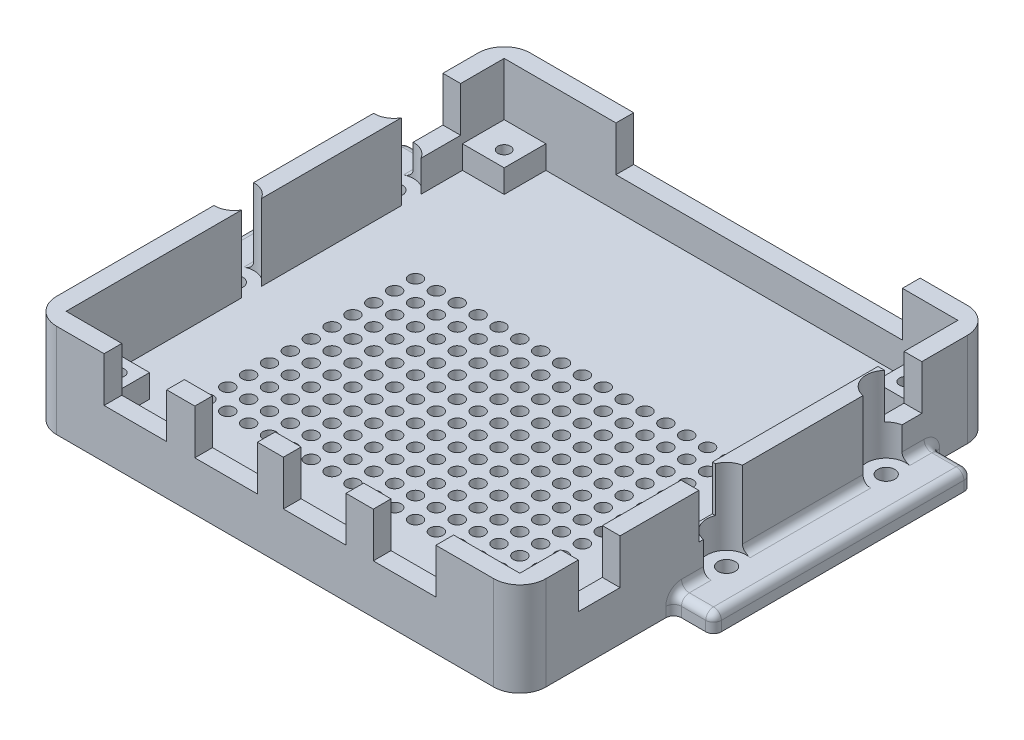
from build123d import *

# Parameters (mm, degrees)
BOSS_EXTRUDE2_DEPTH   = 10.922
BOSS_EXTRUDE2_2_DEPTH = 10.922
BOSS_EXTRUDE2_3_DEPTH = 10.922
SKETCH1_W             = 4.318
SKETCH1_H             = 40.3352
BOSS_EXTRUDE2_4_DEPTH = 10.922
SKETCH1_H_2           = 19.177
BOSS_EXTRUDE2_5_DEPTH = 10.922
BOSS_EXTRUDE2_6_DEPTH = 10.922
SKETCH1_W_2           = 6.6548
SKETCH1_H_3           = 4.318
BOSS_EXTRUDE2_7_DEPTH = 10.922
SKETCH1_W_3           = 6.3246
BOSS_EXTRUDE2_8_DEPTH = 10.922
SKETCH1_W_4           = 6.858
BOSS_EXTRUDE2_9_DEPTH = 10.922
SKETCH2_W             = 4.318
SKETCH2_H             = 86.36
SKETCH2_W_2           = 90.17
SKETCH2_H_2           = 4.318
SKETCH2_H_3           = 12.70543687
SKETCH2_H_4           = 0.4445
SKETCH2_H_5           = 73.21006313
SKETCH2_W_3           = 3.4036
SKETCH2_W_4           = 86.7664
BOSS_EXTRUDE4_DEPTH   = 7.62
SKETCH5_W             = 7.62
SKETCH5_H             = 7.62
SKETCH5_R             = 1.524
BOSS_EXTRUDE6_DEPTH   = 5.62
SKETCH6_W             = 119.126
SKETCH6_H             = 115.316
SKETCH6_R             = 1.524
BOSS_EXTRUDE7_DEPTH   = 4.318
SKETCH7_R             = 1.5875
CUT_EXTRUDE1_DEPTH    = 4.318
FILLET1_R             = 6.35
BOSS_EXTRUDE8_DEPTH   = 4.318
SKETCH9_R             = 2.0955
CUT_EXTRUDE2_DEPTH    = 22.86
SKETCH10_R            = 4.826
CUT_EXTRUDE3_DEPTH    = 18.542
FILLET14_R            = 1.905
FILLET15_R            = 1.905


with BuildPart() as part:
    # Sketch1 → Boss-Extrude2 (new body)
    with BuildSketch(Plane(origin=(0, 60.324413717, 0), x_dir=(1, 0, 0), z_dir=(0, 1, 0))):
        Polygon((-24.756688695, -58.711999847), (-24.756688695, -146.400062977), (-6.875088695, -146.400062977), (-6.875088695, -142.082062977), (-20.438688695, -142.082062977), (-20.438688695, -58.711999847), align=None)
    extrude(amount=BOSS_EXTRUDE2_DEPTH)



with BuildPart() as body_2:
    # Sketch1 → Boss-Extrude2 2 (new body)
    with BuildSketch(Plane(origin=(0, 60.324413717, 0), x_dir=(1, 0, 0), z_dir=(0, 1, 0))):
        Polygon((6.788511305, -35.402062977), (-20.438688695, -35.402062977), (-20.438688695, -46.006562977), (-24.756688695, -46.006562977), (-24.756688695, -31.084062977), (6.788511305, -31.084062977), align=None)
    extrude(amount=BOSS_EXTRUDE2_2_DEPTH)


with BuildPart() as body_3:
    # Sketch1 → Boss-Extrude2 3 (new body)
    with BuildSketch(Plane(origin=(0, 60.324413717, 0), x_dir=(1, 0, 0), z_dir=(0, 1, 0))):
        Polygon((90.051311305, -48.508462977), (90.051311305, -35.402062977), (76.540111305, -35.402062977), (76.540111305, -31.084062977), (94.369311305, -31.084062977), (94.369311305, -48.508462977), align=None)
    extrude(amount=BOSS_EXTRUDE2_3_DEPTH)


with BuildPart() as body_4:
    # Sketch1 → Boss-Extrude2 4 (new body)
    with BuildSketch(Plane(origin=(0, 60.324413717, 0), x_dir=(1, 0, 0), z_dir=(0, 1, 0))):
        with Locations((92.210311305, -75.026062977)):
            Rectangle(SKETCH1_W, SKETCH1_H)
    extrude(amount=BOSS_EXTRUDE2_4_DEPTH)


with BuildPart() as body_5:
    # Sketch1 → Boss-Extrude2 5 (new body)
    with BuildSketch(Plane(origin=(0, 60.324413717, 0), x_dir=(1, 0, 0), z_dir=(0, 1, 0))):
        with Locations((92.210311305, -112.402162977)):
            Rectangle(SKETCH1_W, SKETCH1_H_2)
    extrude(amount=BOSS_EXTRUDE2_5_DEPTH)


with BuildPart() as body_6:
    # Sketch1 → Boss-Extrude2 6 (new body)
    with BuildSketch(Plane(origin=(0, 60.324413717, 0), x_dir=(1, 0, 0), z_dir=(0, 1, 0))):
        Polygon((73.922311305, -142.082062977), (90.051311305, -142.082062977), (90.051311305, -132.150662977), (94.369311305, -132.150662977), (94.369311305, -146.400062977), (73.922311305, -146.400062977), align=None)
    extrude(amount=BOSS_EXTRUDE2_6_DEPTH)


with BuildPart() as body_7:
    # Sketch1 → Boss-Extrude2 7 (new body)
    with BuildSketch(Plane(origin=(0, 60.324413717, 0), x_dir=(1, 0, 0), z_dir=(0, 1, 0))):
        with Locations((55.354911305, -144.241062977)):
            Rectangle(SKETCH1_W_2, SKETCH1_H_3)
    extrude(amount=BOSS_EXTRUDE2_7_DEPTH)


with BuildPart() as body_8:
    # Sketch1 → Boss-Extrude2 8 (new body)
    with BuildSketch(Plane(origin=(0, 60.324413717, 0), x_dir=(1, 0, 0), z_dir=(0, 1, 0))):
        with Locations((33.625211305, -144.241062977)):
            Rectangle(SKETCH1_W_3, SKETCH1_H_3)
    extrude(amount=BOSS_EXTRUDE2_8_DEPTH)


with BuildPart() as body_9:
    # Sketch1 → Boss-Extrude2 9 (new body)
    with BuildSketch(Plane(origin=(0, 60.324413717, 0), x_dir=(1, 0, 0), z_dir=(0, 1, 0))):
        with Locations((11.793911305, -144.241062977)):
            Rectangle(SKETCH1_W_4, SKETCH1_H_3)
    extrude(amount=BOSS_EXTRUDE2_9_DEPTH)


with BuildPart() as part_1:
    add(part.part)

    add(body_2.part)  # Boss-Extrude4 merges body 2

    add(body_3.part)  # Boss-Extrude4 merges body 3

    add(body_4.part)  # Boss-Extrude4 merges body 4

    add(body_5.part)  # Boss-Extrude4 merges body 5

    add(body_6.part)  # Boss-Extrude4 merges body 6

    add(body_7.part)  # Boss-Extrude4 merges body 7

    add(body_8.part)  # Boss-Extrude4 merges body 8

    add(body_9.part)  # Boss-Extrude4 merges body 9
    # Sketch2 → Boss-Extrude4 (add)
    with BuildSketch(Plane.XZ.offset(-60.324413717)):
        Polygon((94.369311305, 31.084062977), (94.369311305, 45.562062977), (90.051311305, 45.562062977), (90.051311305, 35.402062977), (79.891311305, 35.402062977), (79.891311305, 31.084062977), align=None)
        with Locations((92.210311305, 88.742062977)):
            Rectangle(SKETCH2_W, SKETCH2_H)
        Polygon((94.369311305, 146.400062977), (79.891311305, 146.400062977), (79.891311305, 142.082062977), (90.051311305, 142.082062977), (90.051311305, 131.922062977), (94.369311305, 131.922062977), align=None)
        with Locations((34.806311305, 33.243062977)):
            Rectangle(SKETCH2_W_2, SKETCH2_H_2)
        Polygon((-20.438688695, 45.562062977), (-24.756688695, 45.562062977), (-24.756688695, 31.084062977), (-10.278688695, 31.084062977), (-10.278688695, 35.402062977), (-20.438688695, 35.402062977), align=None)
        with Locations((-22.597688695, 52.359281412)):
            Rectangle(SKETCH2_W, SKETCH2_H_3)
        with Locations((-22.597688695, 45.784312977)):
            Rectangle(SKETCH2_W, SKETCH2_H_4)
        with Locations((-22.597688695, 95.317031412)):
            Rectangle(SKETCH2_W, SKETCH2_H_5)
        Polygon((-10.278688695, 146.400062977), (-24.756688695, 146.400062977), (-24.756688695, 131.922062977), (-20.438688695, 131.922062977), (-20.438688695, 142.082062977), (-10.278688695, 142.082062977), align=None)
        with Locations((-8.576888695, 144.241062977)):
            Rectangle(SKETCH2_W_3, SKETCH2_H_2)
        with Locations((36.508111305, 144.241062977)):
            Rectangle(SKETCH2_W_4, SKETCH2_H_2)
    extrude(amount=BOSS_EXTRUDE4_DEPTH)

    # Sketch5 → Boss-Extrude6 (add)
    # profile 1 of 8: a face of its own
    with BuildSketch(Plane.XZ.offset(-58.324413717)):
        Polygon((-20.438688695, 131.922062977), (-17.898688695, 131.922062977), (-17.898688695, 139.542062977), (-10.278688695, 139.542062977), (-10.278688695, 142.082062977), (-20.438688695, 142.082062977), align=None)
    # profile 2 of 8: a face of its own
    with BuildSketch(Plane.XZ.offset(-58.324413717)):
        with Locations((-14.088688695, 135.732062977)):
            Rectangle(SKETCH5_W, SKETCH5_H)
        with Locations(Location((-14.088688695, 135.732062977, 0), (0, 0, 270))):
            Circle(SKETCH5_R, mode=Mode.SUBTRACT)
    # profile 3 of 8: a face of its own
    with BuildSketch(Plane.XZ.offset(-58.324413717)):
        with Locations((83.701311305, 135.732062977)):
            Rectangle(SKETCH5_W, SKETCH5_H)
        with Locations(Location((83.701311305, 135.732062977, 0), (0, 0, 270))):
            Circle(SKETCH5_R, mode=Mode.SUBTRACT)
    # profile 4 of 8: a face of its own
    with BuildSketch(Plane.XZ.offset(-58.324413717)):
        Polygon((79.891311305, 142.082062977), (79.891311305, 139.542062977), (87.511311305, 139.542062977), (87.511311305, 131.922062977), (90.051311305, 131.922062977), (90.051311305, 142.082062977), align=None)
    # profile 5 of 8: a face of its own
    with BuildSketch(Plane.XZ.offset(-58.324413717)):
        with Locations((83.701311305, 41.752062977)):
            Rectangle(SKETCH5_W, SKETCH5_H)
        with Locations(Location((83.701311305, 41.752062977, 0), (0, 0, 270))):
            Circle(SKETCH5_R, mode=Mode.SUBTRACT)
    # profile 6 of 8: a face of its own
    with BuildSketch(Plane.XZ.offset(-58.324413717)):
        Polygon((87.511311305, 37.942062977), (79.891311305, 37.942062977), (79.891311305, 35.402062977), (90.051311305, 35.402062977), (90.051311305, 45.562062977), (87.511311305, 45.562062977), align=None)
    # profile 7 of 8: a face of its own
    with BuildSketch(Plane.XZ.offset(-58.324413717)):
        with Locations((-14.088688695, 41.752062977)):
            Rectangle(SKETCH5_W, SKETCH5_H)
        with Locations(Location((-14.088688695, 41.752062977, 0), (0, 0, 270))):
            Circle(SKETCH5_R, mode=Mode.SUBTRACT)
    # profile 8 of 8: a face of its own
    with BuildSketch(Plane.XZ.offset(-58.324413717)):
        Polygon((-17.898688695, 37.942062977), (-17.898688695, 45.562062977), (-20.438688695, 45.562062977), (-20.438688695, 35.402062977), (-10.278688695, 35.402062977), (-10.278688695, 37.942062977), align=None)
    extrude(amount=BOSS_EXTRUDE6_DEPTH)

    # Sketch6 → Boss-Extrude7 (add)
    with BuildSketch(Plane(origin=(0, 52.704413717, 0), x_dir=(-1, 0, 0), z_dir=(0, -1, 0))):
        with Locations((-34.806311305, -88.742062977)):
            Rectangle(SKETCH6_W, SKETCH6_H)
        with Locations(Location((14.088688695, -135.732062977, 0), (0, 0, 90))):
            Circle(SKETCH6_R, mode=Mode.SUBTRACT)
        with Locations(Location((-83.701311305, -135.732062977, 0), (0, 0, 90))):
            Circle(SKETCH6_R, mode=Mode.SUBTRACT)
        with Locations(Location((-83.701311305, -41.752062977, 0), (0, 0, 90))):
            Circle(SKETCH6_R, mode=Mode.SUBTRACT)
        with Locations(Location((14.088688695, -41.752062977, 0), (0, 0, 90))):
            Circle(SKETCH6_R, mode=Mode.SUBTRACT)
    extrude(amount=BOSS_EXTRUDE7_DEPTH)

    # Sketch7 → Cut-Extrude1 (cut)
    with BuildSketch(Plane.XZ.offset(-48.386413717)):
        with Locations(Location((72.906311305, 74.137062977, 0), (0, 0, 270))):
            Circle(SKETCH7_R)
        with Locations(Location((67.826311305, 74.137062977, 0), (0, 0, 270))):
            Circle(SKETCH7_R)
        with Locations(Location((62.746311305, 74.137062977, 0), (0, 0, 270))):
            Circle(SKETCH7_R)
        with Locations(Location((57.666311305, 74.137062977, 0), (0, 0, 270))):
            Circle(SKETCH7_R)
        with Locations(Location((52.586311305, 74.137062977, 0), (0, 0, 270))):
            Circle(SKETCH7_R)
        with Locations(Location((47.506311305, 74.137062977, 0), (0, 0, 270))):
            Circle(SKETCH7_R)
        with Locations(Location((42.426311305, 74.137062977, 0), (0, 0, 270))):
            Circle(SKETCH7_R)
        with Locations(Location((37.346311305, 74.137062977, 0), (0, 0, 270))):
            Circle(SKETCH7_R)
        with Locations(Location((32.266311305, 74.137062977, 0), (0, 0, 270))):
            Circle(SKETCH7_R)
        with Locations(Location((27.186311305, 74.137062977, 0), (0, 0, 270))):
            Circle(SKETCH7_R)
        with Locations(Location((22.106311305, 74.137062977, 0), (0, 0, 270))):
            Circle(SKETCH7_R)
        with Locations(Location((17.026311305, 74.137062977, 0), (0, 0, 270))):
            Circle(SKETCH7_R)
        with Locations(Location((11.946311305, 74.137062977, 0), (0, 0, 270))):
            Circle(SKETCH7_R)
        with Locations(Location((6.866311305, 74.137062977, 0), (0, 0, 270))):
            Circle(SKETCH7_R)
        with Locations(Location((1.786311305, 74.137062977, 0), (0, 0, 270))):
            Circle(SKETCH7_R)
        with Locations(Location((-3.293688695, 74.137062977, 0), (0, 0, 270))):
            Circle(SKETCH7_R)
        with Locations(Location((72.906311305, 79.217062977, 0), (0, 0, 270))):
            Circle(SKETCH7_R)
        with Locations(Location((67.826311305, 79.217062977, 0), (0, 0, 270))):
            Circle(SKETCH7_R)
        with Locations(Location((62.746311305, 79.217062977, 0), (0, 0, 270))):
            Circle(SKETCH7_R)
        with Locations(Location((57.666311305, 79.217062977, 0), (0, 0, 270))):
            Circle(SKETCH7_R)
        with Locations(Location((52.586311305, 79.217062977, 0), (0, 0, 270))):
            Circle(SKETCH7_R)
        with Locations(Location((47.506311305, 79.217062977, 0), (0, 0, 270))):
            Circle(SKETCH7_R)
        with Locations(Location((42.426311305, 79.217062977, 0), (0, 0, 270))):
            Circle(SKETCH7_R)
        with Locations(Location((37.346311305, 79.217062977, 0), (0, 0, 270))):
            Circle(SKETCH7_R)
        with Locations(Location((32.266311305, 79.217062977, 0), (0, 0, 270))):
            Circle(SKETCH7_R)
        with Locations(Location((27.186311305, 79.217062977, 0), (0, 0, 270))):
            Circle(SKETCH7_R)
        with Locations(Location((22.106311305, 79.217062977, 0), (0, 0, 270))):
            Circle(SKETCH7_R)
        with Locations(Location((17.026311305, 79.217062977, 0), (0, 0, 270))):
            Circle(SKETCH7_R)
        with Locations(Location((11.946311305, 79.217062977, 0), (0, 0, 270))):
            Circle(SKETCH7_R)
        with Locations(Location((6.866311305, 79.217062977, 0), (0, 0, 270))):
            Circle(SKETCH7_R)
        with Locations(Location((1.786311305, 79.217062977, 0), (0, 0, 270))):
            Circle(SKETCH7_R)
        with Locations(Location((-3.293688695, 79.217062977, 0), (0, 0, 270))):
            Circle(SKETCH7_R)
        with Locations(Location((72.906311305, 84.297062977, 0), (0, 0, 270))):
            Circle(SKETCH7_R)
        with Locations(Location((67.826311305, 84.297062977, 0), (0, 0, 270))):
            Circle(SKETCH7_R)
        with Locations(Location((62.746311305, 84.297062977, 0), (0, 0, 270))):
            Circle(SKETCH7_R)
        with Locations(Location((57.666311305, 84.297062977, 0), (0, 0, 270))):
            Circle(SKETCH7_R)
        with Locations(Location((52.586311305, 84.297062977, 0), (0, 0, 270))):
            Circle(SKETCH7_R)
        with Locations(Location((47.506311305, 84.297062977, 0), (0, 0, 270))):
            Circle(SKETCH7_R)
        with Locations(Location((42.426311305, 84.297062977, 0), (0, 0, 270))):
            Circle(SKETCH7_R)
        with Locations(Location((37.346311305, 84.297062977, 0), (0, 0, 270))):
            Circle(SKETCH7_R)
        with Locations(Location((32.266311305, 84.297062977, 0), (0, 0, 270))):
            Circle(SKETCH7_R)
        with Locations(Location((27.186311305, 84.297062977, 0), (0, 0, 270))):
            Circle(SKETCH7_R)
        with Locations(Location((22.106311305, 84.297062977, 0), (0, 0, 270))):
            Circle(SKETCH7_R)
        with Locations(Location((17.026311305, 84.297062977, 0), (0, 0, 270))):
            Circle(SKETCH7_R)
        with Locations(Location((11.946311305, 84.297062977, 0), (0, 0, 270))):
            Circle(SKETCH7_R)
        with Locations(Location((6.866311305, 84.297062977, 0), (0, 0, 270))):
            Circle(SKETCH7_R)
        with Locations(Location((1.786311305, 84.297062977, 0), (0, 0, 270))):
            Circle(SKETCH7_R)
        with Locations(Location((-3.293688695, 84.297062977, 0), (0, 0, 270))):
            Circle(SKETCH7_R)
        with Locations(Location((72.906311305, 89.377062977, 0), (0, 0, 270))):
            Circle(SKETCH7_R)
        with Locations(Location((67.826311305, 89.377062977, 0), (0, 0, 270))):
            Circle(SKETCH7_R)
        with Locations(Location((62.746311305, 89.377062977, 0), (0, 0, 270))):
            Circle(SKETCH7_R)
        with Locations(Location((57.666311305, 89.377062977, 0), (0, 0, 270))):
            Circle(SKETCH7_R)
        with Locations(Location((52.586311305, 89.377062977, 0), (0, 0, 270))):
            Circle(SKETCH7_R)
        with Locations(Location((47.506311305, 89.377062977, 0), (0, 0, 270))):
            Circle(SKETCH7_R)
        with Locations(Location((42.426311305, 89.377062977, 0), (0, 0, 270))):
            Circle(SKETCH7_R)
        with Locations(Location((37.346311305, 89.377062977, 0), (0, 0, 270))):
            Circle(SKETCH7_R)
        with Locations(Location((32.266311305, 89.377062977, 0), (0, 0, 270))):
            Circle(SKETCH7_R)
        with Locations(Location((27.186311305, 89.377062977, 0), (0, 0, 270))):
            Circle(SKETCH7_R)
        with Locations(Location((22.106311305, 89.377062977, 0), (0, 0, 270))):
            Circle(SKETCH7_R)
        with Locations(Location((17.026311305, 89.377062977, 0), (0, 0, 270))):
            Circle(SKETCH7_R)
        with Locations(Location((11.946311305, 89.377062977, 0), (0, 0, 270))):
            Circle(SKETCH7_R)
        with Locations(Location((6.866311305, 89.377062977, 0), (0, 0, 270))):
            Circle(SKETCH7_R)
        with Locations(Location((1.786311305, 89.377062977, 0), (0, 0, 270))):
            Circle(SKETCH7_R)
        with Locations(Location((-3.293688695, 89.377062977, 0), (0, 0, 270))):
            Circle(SKETCH7_R)
        with Locations(Location((72.906311305, 94.457062977, 0), (0, 0, 270))):
            Circle(SKETCH7_R)
        with Locations(Location((67.826311305, 94.457062977, 0), (0, 0, 270))):
            Circle(SKETCH7_R)
        with Locations(Location((62.746311305, 94.457062977, 0), (0, 0, 270))):
            Circle(SKETCH7_R)
        with Locations(Location((57.666311305, 94.457062977, 0), (0, 0, 270))):
            Circle(SKETCH7_R)
        with Locations(Location((52.586311305, 94.457062977, 0), (0, 0, 270))):
            Circle(SKETCH7_R)
        with Locations(Location((47.506311305, 94.457062977, 0), (0, 0, 270))):
            Circle(SKETCH7_R)
        with Locations(Location((42.426311305, 94.457062977, 0), (0, 0, 270))):
            Circle(SKETCH7_R)
        with Locations(Location((37.346311305, 94.457062977, 0), (0, 0, 270))):
            Circle(SKETCH7_R)
        with Locations(Location((32.266311305, 94.457062977, 0), (0, 0, 270))):
            Circle(SKETCH7_R)
        with Locations(Location((27.186311305, 94.457062977, 0), (0, 0, 270))):
            Circle(SKETCH7_R)
        with Locations(Location((22.106311305, 94.457062977, 0), (0, 0, 270))):
            Circle(SKETCH7_R)
        with Locations(Location((17.026311305, 94.457062977, 0), (0, 0, 270))):
            Circle(SKETCH7_R)
        with Locations(Location((11.946311305, 94.457062977, 0), (0, 0, 270))):
            Circle(SKETCH7_R)
        with Locations(Location((6.866311305, 94.457062977, 0), (0, 0, 270))):
            Circle(SKETCH7_R)
        with Locations(Location((1.786311305, 94.457062977, 0), (0, 0, 270))):
            Circle(SKETCH7_R)
        with Locations(Location((-3.293688695, 94.457062977, 0), (0, 0, 270))):
            Circle(SKETCH7_R)
        with Locations(Location((72.906311305, 99.537062977, 0), (0, 0, 270))):
            Circle(SKETCH7_R)
        with Locations(Location((67.826311305, 99.537062977, 0), (0, 0, 270))):
            Circle(SKETCH7_R)
        with Locations(Location((62.746311305, 99.537062977, 0), (0, 0, 270))):
            Circle(SKETCH7_R)
        with Locations(Location((57.666311305, 99.537062977, 0), (0, 0, 270))):
            Circle(SKETCH7_R)
        with Locations(Location((52.586311305, 99.537062977, 0), (0, 0, 270))):
            Circle(SKETCH7_R)
        with Locations(Location((47.506311305, 99.537062977, 0), (0, 0, 270))):
            Circle(SKETCH7_R)
        with Locations(Location((42.426311305, 99.537062977, 0), (0, 0, 270))):
            Circle(SKETCH7_R)
        with Locations(Location((37.346311305, 99.537062977, 0), (0, 0, 270))):
            Circle(SKETCH7_R)
        with Locations(Location((32.266311305, 99.537062977, 0), (0, 0, 270))):
            Circle(SKETCH7_R)
        with Locations(Location((27.186311305, 99.537062977, 0), (0, 0, 270))):
            Circle(SKETCH7_R)
        with Locations(Location((22.106311305, 99.537062977, 0), (0, 0, 270))):
            Circle(SKETCH7_R)
        with Locations(Location((17.026311305, 99.537062977, 0), (0, 0, 270))):
            Circle(SKETCH7_R)
        with Locations(Location((11.946311305, 99.537062977, 0), (0, 0, 270))):
            Circle(SKETCH7_R)
        with Locations(Location((6.866311305, 99.537062977, 0), (0, 0, 270))):
            Circle(SKETCH7_R)
        with Locations(Location((1.786311305, 99.537062977, 0), (0, 0, 270))):
            Circle(SKETCH7_R)
        with Locations(Location((-3.293688695, 99.537062977, 0), (0, 0, 270))):
            Circle(SKETCH7_R)
        with Locations(Location((72.906311305, 104.617062977, 0), (0, 0, 270))):
            Circle(SKETCH7_R)
        with Locations(Location((67.826311305, 104.617062977, 0), (0, 0, 270))):
            Circle(SKETCH7_R)
        with Locations(Location((62.746311305, 104.617062977, 0), (0, 0, 270))):
            Circle(SKETCH7_R)
        with Locations(Location((57.666311305, 104.617062977, 0), (0, 0, 270))):
            Circle(SKETCH7_R)
        with Locations(Location((52.586311305, 104.617062977, 0), (0, 0, 270))):
            Circle(SKETCH7_R)
        with Locations(Location((47.506311305, 104.617062977, 0), (0, 0, 270))):
            Circle(SKETCH7_R)
        with Locations(Location((42.426311305, 104.617062977, 0), (0, 0, 270))):
            Circle(SKETCH7_R)
        with Locations(Location((37.346311305, 104.617062977, 0), (0, 0, 270))):
            Circle(SKETCH7_R)
        with Locations(Location((32.266311305, 104.617062977, 0), (0, 0, 270))):
            Circle(SKETCH7_R)
        with Locations(Location((27.186311305, 104.617062977, 0), (0, 0, 270))):
            Circle(SKETCH7_R)
        with Locations(Location((22.106311305, 104.617062977, 0), (0, 0, 270))):
            Circle(SKETCH7_R)
        with Locations(Location((17.026311305, 104.617062977, 0), (0, 0, 270))):
            Circle(SKETCH7_R)
        with Locations(Location((11.946311305, 104.617062977, 0), (0, 0, 270))):
            Circle(SKETCH7_R)
        with Locations(Location((6.866311305, 104.617062977, 0), (0, 0, 270))):
            Circle(SKETCH7_R)
        with Locations(Location((1.786311305, 104.617062977, 0), (0, 0, 270))):
            Circle(SKETCH7_R)
        with Locations(Location((-3.293688695, 104.617062977, 0), (0, 0, 270))):
            Circle(SKETCH7_R)
        with Locations(Location((72.906311305, 109.697062977, 0), (0, 0, 270))):
            Circle(SKETCH7_R)
        with Locations(Location((67.826311305, 109.697062977, 0), (0, 0, 270))):
            Circle(SKETCH7_R)
        with Locations(Location((62.746311305, 109.697062977, 0), (0, 0, 270))):
            Circle(SKETCH7_R)
        with Locations(Location((57.666311305, 109.697062977, 0), (0, 0, 270))):
            Circle(SKETCH7_R)
        with Locations(Location((52.586311305, 109.697062977, 0), (0, 0, 270))):
            Circle(SKETCH7_R)
        with Locations(Location((47.506311305, 109.697062977, 0), (0, 0, 270))):
            Circle(SKETCH7_R)
        with Locations(Location((42.426311305, 109.697062977, 0), (0, 0, 270))):
            Circle(SKETCH7_R)
        with Locations(Location((37.346311305, 109.697062977, 0), (0, 0, 270))):
            Circle(SKETCH7_R)
        with Locations(Location((32.266311305, 109.697062977, 0), (0, 0, 270))):
            Circle(SKETCH7_R)
        with Locations(Location((27.186311305, 109.697062977, 0), (0, 0, 270))):
            Circle(SKETCH7_R)
        with Locations(Location((22.106311305, 109.697062977, 0), (0, 0, 270))):
            Circle(SKETCH7_R)
        with Locations(Location((17.026311305, 109.697062977, 0), (0, 0, 270))):
            Circle(SKETCH7_R)
        with Locations(Location((11.946311305, 109.697062977, 0), (0, 0, 270))):
            Circle(SKETCH7_R)
        with Locations(Location((6.866311305, 109.697062977, 0), (0, 0, 270))):
            Circle(SKETCH7_R)
        with Locations(Location((1.786311305, 109.697062977, 0), (0, 0, 270))):
            Circle(SKETCH7_R)
        with Locations(Location((-3.293688695, 109.697062977, 0), (0, 0, 270))):
            Circle(SKETCH7_R)
        with Locations(Location((72.906311305, 114.777062977, 0), (0, 0, 270))):
            Circle(SKETCH7_R)
        with Locations(Location((67.826311305, 114.777062977, 0), (0, 0, 270))):
            Circle(SKETCH7_R)
        with Locations(Location((62.746311305, 114.777062977, 0), (0, 0, 270))):
            Circle(SKETCH7_R)
        with Locations(Location((57.666311305, 114.777062977, 0), (0, 0, 270))):
            Circle(SKETCH7_R)
        with Locations(Location((52.586311305, 114.777062977, 0), (0, 0, 270))):
            Circle(SKETCH7_R)
        with Locations(Location((47.506311305, 114.777062977, 0), (0, 0, 270))):
            Circle(SKETCH7_R)
        with Locations(Location((42.426311305, 114.777062977, 0), (0, 0, 270))):
            Circle(SKETCH7_R)
        with Locations(Location((37.346311305, 114.777062977, 0), (0, 0, 270))):
            Circle(SKETCH7_R)
        with Locations(Location((32.266311305, 114.777062977, 0), (0, 0, 270))):
            Circle(SKETCH7_R)
        with Locations(Location((27.186311305, 114.777062977, 0), (0, 0, 270))):
            Circle(SKETCH7_R)
        with Locations(Location((22.106311305, 114.777062977, 0), (0, 0, 270))):
            Circle(SKETCH7_R)
        with Locations(Location((17.026311305, 114.777062977, 0), (0, 0, 270))):
            Circle(SKETCH7_R)
        with Locations(Location((11.946311305, 114.777062977, 0), (0, 0, 270))):
            Circle(SKETCH7_R)
        with Locations(Location((6.866311305, 114.777062977, 0), (0, 0, 270))):
            Circle(SKETCH7_R)
        with Locations(Location((1.786311305, 114.777062977, 0), (0, 0, 270))):
            Circle(SKETCH7_R)
        with Locations(Location((-3.293688695, 114.777062977, 0), (0, 0, 270))):
            Circle(SKETCH7_R)
        with Locations(Location((72.906311305, 119.857062977, 0), (0, 0, 270))):
            Circle(SKETCH7_R)
        with Locations(Location((67.826311305, 119.857062977, 0), (0, 0, 270))):
            Circle(SKETCH7_R)
        with Locations(Location((62.746311305, 119.857062977, 0), (0, 0, 270))):
            Circle(SKETCH7_R)
        with Locations(Location((57.666311305, 119.857062977, 0), (0, 0, 270))):
            Circle(SKETCH7_R)
        with Locations(Location((52.586311305, 119.857062977, 0), (0, 0, 270))):
            Circle(SKETCH7_R)
        with Locations(Location((47.506311305, 119.857062977, 0), (0, 0, 270))):
            Circle(SKETCH7_R)
        with Locations(Location((42.426311305, 119.857062977, 0), (0, 0, 270))):
            Circle(SKETCH7_R)
        with Locations(Location((37.346311305, 119.857062977, 0), (0, 0, 270))):
            Circle(SKETCH7_R)
        with Locations(Location((32.266311305, 119.857062977, 0), (0, 0, 270))):
            Circle(SKETCH7_R)
        with Locations(Location((27.186311305, 119.857062977, 0), (0, 0, 270))):
            Circle(SKETCH7_R)
        with Locations(Location((22.106311305, 119.857062977, 0), (0, 0, 270))):
            Circle(SKETCH7_R)
        with Locations(Location((17.026311305, 119.857062977, 0), (0, 0, 270))):
            Circle(SKETCH7_R)
        with Locations(Location((11.946311305, 119.857062977, 0), (0, 0, 270))):
            Circle(SKETCH7_R)
        with Locations(Location((6.866311305, 119.857062977, 0), (0, 0, 270))):
            Circle(SKETCH7_R)
        with Locations(Location((1.786311305, 119.857062977, 0), (0, 0, 270))):
            Circle(SKETCH7_R)
        with Locations(Location((-3.293688695, 119.857062977, 0), (0, 0, 270))):
            Circle(SKETCH7_R)
        with Locations(Location((72.906311305, 124.937062977, 0), (0, 0, 270))):
            Circle(SKETCH7_R)
        with Locations(Location((67.826311305, 124.937062977, 0), (0, 0, 270))):
            Circle(SKETCH7_R)
        with Locations(Location((62.746311305, 124.937062977, 0), (0, 0, 270))):
            Circle(SKETCH7_R)
        with Locations(Location((57.666311305, 124.937062977, 0), (0, 0, 270))):
            Circle(SKETCH7_R)
        with Locations(Location((52.586311305, 124.937062977, 0), (0, 0, 270))):
            Circle(SKETCH7_R)
        with Locations(Location((47.506311305, 124.937062977, 0), (0, 0, 270))):
            Circle(SKETCH7_R)
        with Locations(Location((42.426311305, 124.937062977, 0), (0, 0, 270))):
            Circle(SKETCH7_R)
        with Locations(Location((37.346311305, 124.937062977, 0), (0, 0, 270))):
            Circle(SKETCH7_R)
        with Locations(Location((32.266311305, 124.937062977, 0), (0, 0, 270))):
            Circle(SKETCH7_R)
        with Locations(Location((27.186311305, 124.937062977, 0), (0, 0, 270))):
            Circle(SKETCH7_R)
        with Locations(Location((22.106311305, 124.937062977, 0), (0, 0, 270))):
            Circle(SKETCH7_R)
        with Locations(Location((17.026311305, 124.937062977, 0), (0, 0, 270))):
            Circle(SKETCH7_R)
        with Locations(Location((11.946311305, 124.937062977, 0), (0, 0, 270))):
            Circle(SKETCH7_R)
        with Locations(Location((6.866311305, 124.937062977, 0), (0, 0, 270))):
            Circle(SKETCH7_R)
        with Locations(Location((1.786311305, 124.937062977, 0), (0, 0, 270))):
            Circle(SKETCH7_R)
        with Locations(Location((-3.293688695, 124.937062977, 0), (0, 0, 270))):
            Circle(SKETCH7_R)
    extrude(amount=-CUT_EXTRUDE1_DEPTH, mode=Mode.SUBTRACT)

    # Fillet1
    fillet1_edges = [part_1.edges().sort_by_distance(p)[0] for p in [
        (-24.756688695, 59.816413717, 146.400062977),
        (94.369311305, 59.816413717, 146.400062977),
        (-24.756688695, 59.816413717, 31.084062977),
        (94.369311305, 59.816413717, 31.084062977),
    ]]
    fillet(fillet1_edges, radius=FILLET1_R)

    # Sketch8 → Boss-Extrude8 (add)
    with BuildSketch(Plane.XZ.offset(-48.386413717)):
        with BuildLine():
            Line((-34.472188695, 108.935062977), (-34.472188695, 46.070062977))
            Line((-34.472188695, 46.070062977), (-24.756688695, 46.070062977))
            Line((-24.756688695, 46.070062977), (-24.756688695, 55.979915002))
            ThreePointArc((-24.756688695, 55.979915002), (-26.725188695, 58.071562977), (-24.756688695, 60.163210952))
            Line((-24.756688695, 60.163210952), (-24.756688695, 94.841915002))
            ThreePointArc((-24.756688695, 94.841915002), (-26.725188695, 96.933562977), (-24.756688695, 99.025210952))
            Line((-24.756688695, 99.025210952), (-24.756688695, 108.935062977))
            Line((-24.756688695, 108.935062977), (-34.472188695, 108.935062977))
        make_face()
        with BuildLine():
            Line((94.369311305, 56.173985772), (94.369311305, 46.070062977))
            Line((94.369311305, 46.070062977), (104.084811305, 46.070062977))
            Line((104.084811305, 46.070062977), (104.084811305, 108.935062977))
            Line((104.084811305, 108.935062977), (94.369311305, 108.935062977))
            Line((94.369311305, 108.935062977), (94.369311305, 98.831140182))
            ThreePointArc((94.369311305, 98.831140182), (96.382637936, 98.701898317), (97.353811305, 96.933562977))
            ThreePointArc((97.353811305, 96.933562977), (96.382637936, 95.165227637), (94.369311305, 95.035985772))
            Line((94.369311305, 95.035985772), (94.369311305, 59.969140182))
            ThreePointArc((94.369311305, 59.969140182), (96.382637936, 59.839898317), (97.353811305, 58.071562977))
            ThreePointArc((97.353811305, 58.071562977), (96.382637936, 56.303227637), (94.369311305, 56.173985772))
        make_face()
    extrude(amount=-BOSS_EXTRUDE8_DEPTH)

    # Sketch9 → Cut-Extrude2 (cut)
    with BuildSketch(Plane.XZ.offset(-48.386413717)):
        with Locations(Location((-24.629688695, 58.071562977, 0), (0, 0, 270))):
            Circle(SKETCH9_R)
        with Locations(Location((95.258311305, 96.933562977, 0), (0, 0, 270))):
            Circle(SKETCH9_R)
        with Locations(Location((-24.629688695, 96.933562977, 0), (0, 0, 270))):
            Circle(SKETCH9_R)
        with Locations(Location((95.258311305, 58.071562977, 0), (0, 0, 270))):
            Circle(SKETCH9_R)
    extrude(amount=-CUT_EXTRUDE2_DEPTH, mode=Mode.SUBTRACT)

    # Sketch10 → Cut-Extrude3 (cut)
    with BuildSketch(Plane(origin=(0, 52.704413717, 0), x_dir=(1, 0, 0), z_dir=(0, 1, 0))):
        with Locations((95.258311305, -96.933562977)):
            Circle(SKETCH10_R)
        with Locations((95.258311305, -58.071562977)):
            Circle(SKETCH10_R)
        with Locations((-24.629688695, -96.933562977)):
            Circle(SKETCH10_R)
        with Locations((-24.629688695, -58.071562977)):
            Circle(SKETCH10_R)
    extrude(amount=CUT_EXTRUDE3_DEPTH, mode=Mode.SUBTRACT)

    # Fillet14
    fillet14_edges = [part_1.edges().sort_by_distance(p)[0] for p in [
        (-29.614438695, 52.704413717, 46.070062977),
        (-34.472188695, 50.545413717, 46.070062977),
        (-34.472188695, 50.545413717, 108.935062977),
        (-34.472188695, 52.704413717, 77.502562977),
        (-29.614438695, 52.704413717, 108.935062977),
        (104.084811305, 52.704413717, 77.502562977),
        (104.084811305, 50.545413717, 108.935062977),
        (99.227061305, 52.704413717, 46.070062977),
        (104.084811305, 50.545413717, 46.070062977),
        (99.227061305, 52.704413717, 108.935062977),
    ]]
    fillet(fillet14_edges, radius=FILLET14_R)

    # Fillet15
    # the kernel refuses this fillet: 1.905 mm, written as the material it adds along each edge
    with BuildSketch(Plane(origin=(94.369311305, 52.704413717, 107.030062977), x_dir=(0, 1, 0), z_dir=(0, 0, -1))) as fillet15_piece_1_section:
        with BuildLine():
            CenterArc((FILLET15_R, FILLET15_R), FILLET15_R, 180, 90)
            Line((0, FILLET15_R), (0, 0))
            Line((0, 0), (FILLET15_R, 0))
        make_face()
    fillet15_piece_1 = extrude(amount=10.115588253, mode=Mode.PRIVATE)
    fillet15_piece_1 = fillet15_piece_1 - Plane(origin=(95.258311305, 53.136984184, 96.933562977), x_dir=(1, 0, 0), z_dir=(0, -1, 0)) * Cylinder(4.826, 28, mode=Mode.PRIVATE)
    add(fillet15_piece_1)
    with BuildSketch(Plane(origin=(94.369311305, 52.704413717, 96.95265123), x_dir=(1, 0, 0), z_dir=(0, 0, -1))) as fillet15_piece_2_section:
        with BuildLine():
            CenterArc((FILLET15_R, -FILLET15_R), FILLET15_R, 90, 90)
            Line((0, -FILLET15_R), (0, 0))
            Line((0, 0), (FILLET15_R, 0))
        make_face()
    fillet15_piece_2 = extrude(amount=38.900176506, mode=Mode.PRIVATE)
    fillet15_piece_2 = fillet15_piece_2 - Plane(origin=(95.258311305, 53.136163377, 96.933562977), x_dir=(1, 0, 0), z_dir=(0, -1, 0)) * Cylinder(4.826, 86, mode=Mode.PRIVATE)
    fillet15_piece_2 = fillet15_piece_2 - Plane(origin=(95.258311305, 53.136163377, 58.071562977), x_dir=(1, 0, 0), z_dir=(0, -1, 0)) * Cylinder(4.826, 86, mode=Mode.PRIVATE)
    add(fillet15_piece_2)
    with BuildSketch(Plane(origin=(-24.756688695, 52.704413717, 96.995391635), x_dir=(-1, 0, 0), z_dir=(0, 0, 1))) as fillet15_piece_3_section:
        with BuildLine():
            CenterArc((FILLET15_R, -FILLET15_R), FILLET15_R, 90, 90)
            Line((0, -FILLET15_R), (0, 0))
            Line((0, 0), (FILLET15_R, 0))
        make_face()
    fillet15_piece_3 = extrude(amount=10.034671342, mode=Mode.PRIVATE)
    fillet15_piece_3 = fillet15_piece_3 - Plane(origin=(-24.629688695, 53.132970012, 96.933562977), x_dir=(1, 0, 0), z_dir=(0, -1, 0)) * Cylinder(4.826, 28, mode=Mode.PRIVATE)
    add(fillet15_piece_3)
    with BuildSketch(Plane(origin=(-24.756688695, 52.704413717, 58.133391635), x_dir=(-1, 0, 0), z_dir=(0, 0, 1))) as fillet15_piece_4_section:
        with BuildLine():
            CenterArc((FILLET15_R, -FILLET15_R), FILLET15_R, 90, 90)
            Line((0, -FILLET15_R), (0, 0))
            Line((0, 0), (FILLET15_R, 0))
        make_face()
    fillet15_piece_4 = extrude(amount=38.738342684, mode=Mode.PRIVATE)
    fillet15_piece_4 = fillet15_piece_4 - Plane(origin=(-24.629688695, 53.134706538, 96.933562977), x_dir=(1, 0, 0), z_dir=(0, -1, 0)) * Cylinder(4.826, 86, mode=Mode.PRIVATE)
    fillet15_piece_4 = fillet15_piece_4 - Plane(origin=(-24.629688695, 53.134706538, 58.071562977), x_dir=(1, 0, 0), z_dir=(0, -1, 0)) * Cylinder(4.826, 86, mode=Mode.PRIVATE)
    add(fillet15_piece_4)
    with BuildSketch(Plane(origin=(94.369311305, 48.386413717, 46.070062977), x_dir=(0, 0, -1), z_dir=(0, 1, 0))) as fillet15_piece_5:
        with BuildLine():
            CenterArc((FILLET15_R, -FILLET15_R), FILLET15_R, 90, 90)
            Line((0, -FILLET15_R), (0, 0))
            Line((0, 0), (FILLET15_R, 0))
        make_face()
    extrude(amount=2.413)
    with BuildSketch(Plane(origin=(94.369311305, 52.704413717, 58.09065123), x_dir=(0, 1, 0), z_dir=(0, 0, -1))) as fillet15_piece_6_section:
        with BuildLine():
            CenterArc((FILLET15_R, FILLET15_R), FILLET15_R, 180, 90)
            Line((0, FILLET15_R), (0, 0))
            Line((0, 0), (FILLET15_R, 0))
        make_face()
    fillet15_piece_6 = extrude(amount=10.115588253, mode=Mode.PRIVATE)
    fillet15_piece_6 = fillet15_piece_6 - Plane(origin=(95.258311305, 53.136984323, 58.071562977), x_dir=(1, 0, 0), z_dir=(0, -1, 0)) * Cylinder(4.826, 28, mode=Mode.PRIVATE)
    add(fillet15_piece_6)
    with BuildSketch(Plane(origin=(94.369311305, 48.386413717, 108.935062977), x_dir=(0, 0, 1), z_dir=(0, 1, 0)), Plane(origin=(-24.756688695, 48.386413717, 108.935062977), x_dir=(-1, 0, 0), z_dir=(0, 1, 0)), Plane(origin=(-24.756688695, 48.386413717, 46.070062977), x_dir=(0, 0, -1), z_dir=(0, 1, 0))) as fillet15_piece_7:
        with BuildLine():
            CenterArc((FILLET15_R, FILLET15_R), FILLET15_R, 180, 90)
            Line((0, FILLET15_R), (0, 0))
            Line((0, 0), (FILLET15_R, 0))
        make_face()
    extrude(amount=2.413)
    with BuildSketch(Plane(origin=(-24.756688695, 52.704413717, 47.975062977), x_dir=(0, 1, 0), z_dir=(0, 0, 1))) as fillet15_piece_8_section:
        with BuildLine():
            CenterArc((FILLET15_R, FILLET15_R), FILLET15_R, 180, 90)
            Line((0, FILLET15_R), (0, 0))
            Line((0, 0), (FILLET15_R, 0))
        make_face()
    fillet15_piece_8 = extrude(amount=10.034671342, mode=Mode.PRIVATE)
    fillet15_piece_8 = fillet15_piece_8 - Plane(origin=(-24.629688695, 53.132969981, 58.071562977), x_dir=(1, 0, 0), z_dir=(0, -1, 0)) * Cylinder(4.826, 28, mode=Mode.PRIVATE)
    add(fillet15_piece_8)
    with BuildSketch(Plane(origin=(94.369311305, 50.799413717, 47.975062977), x_dir=(0, 0, -1), z_dir=(0, -1, 0))) as fillet15_piece_9:
        with BuildLine():
            CenterArc((1.905 + FILLET15_R, FILLET15_R), FILLET15_R, 180, 90)
            Line((1.905, FILLET15_R), (1.905, 0))
            Line((1.905, 0), (1.905 + FILLET15_R, 0))
        make_face()
    revolve(axis=Axis((94.369311305, 50.799413717, 47.975062977), (1, 0, 0)), revolution_arc=90)
    with BuildSketch(Plane(origin=(94.369311305, 50.799413717, 107.030062977), x_dir=(0, 0, 1), z_dir=(0, -1, 0))) as fillet15_piece_10:
        with BuildLine():
            CenterArc((1.905 + FILLET15_R, -FILLET15_R), FILLET15_R, 90, 90)
            Line((1.905, -FILLET15_R), (1.905, 0))
            Line((1.905, 0), (1.905 + FILLET15_R, 0))
        make_face()
    revolve(axis=Axis((94.369311305, 50.799413717, 107.030062977), (-1, 0, 0)), revolution_arc=90)
    with BuildSketch(Plane(origin=(-24.756688695, 50.799413717, 107.030062977), x_dir=(0, 0, 1), z_dir=(0, -1, 0))) as fillet15_piece_11:
        with BuildLine():
            CenterArc((1.905 + FILLET15_R, FILLET15_R), FILLET15_R, 180, 90)
            Line((1.905, FILLET15_R), (1.905, 0))
            Line((1.905, 0), (1.905 + FILLET15_R, 0))
        make_face()
    revolve(axis=Axis((-24.756688695, 50.799413717, 107.030062977), (-1, 0, 0)), revolution_arc=90)
    with BuildSketch(Plane(origin=(-24.756688695, 50.799413717, 47.975062977), x_dir=(0, 1, 0), z_dir=(0, 0, 1))) as fillet15_piece_12:
        with BuildLine():
            CenterArc((1.905 + FILLET15_R, FILLET15_R), FILLET15_R, 180, 90)
            Line((1.905, FILLET15_R), (1.905, 0))
            Line((1.905, 0), (1.905 + FILLET15_R, 0))
        make_face()
    revolve(axis=Axis((-24.756688695, 50.799413717, 47.975062977), (-1, 0, 0)), revolution_arc=90)


solid = part_1.part
